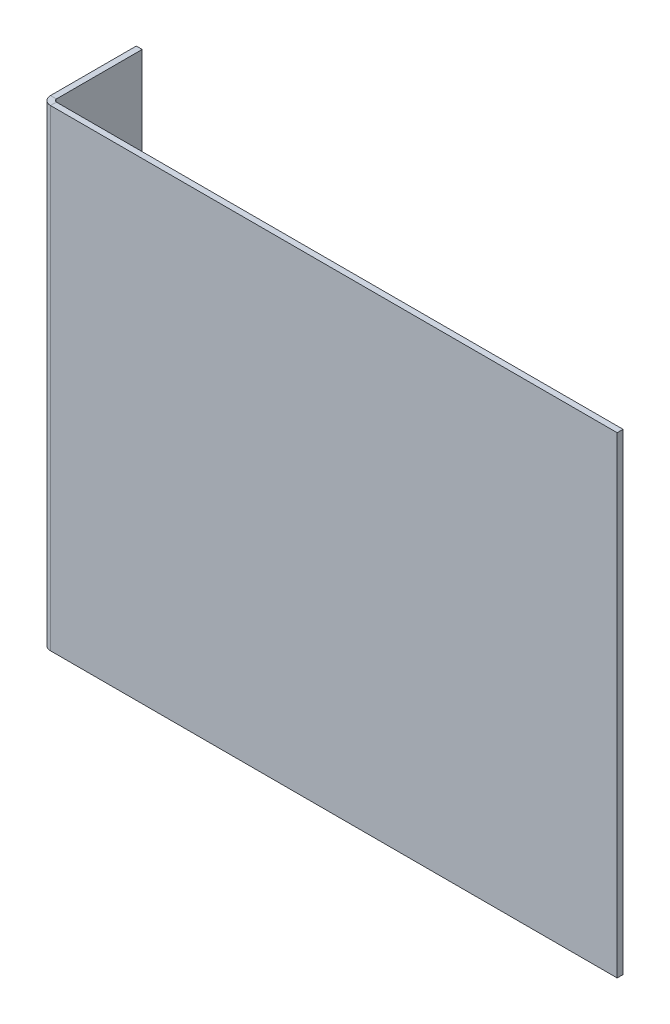
from build123d import *

# Parameters (mm, degrees)
SKETCH1_W          = 152.4
SKETCH1_H          = 127
BASE_FLANGE1_DEPTH = 1.5875
EDGE_FLANGE1_DEPTH = 127


# Sheet-metal steps are written as plain solids
with BuildPart() as part:
    # Sketch1 → Base-Flange1 (new body)
    with BuildSketch(Plane.XY):
        Rectangle(SKETCH1_W, SKETCH1_H)
    extrude(amount=-BASE_FLANGE1_DEPTH)

    # Edge-Flange1 section (across the edge) → Edge-Flange1 (add)
    with BuildSketch(Plane(origin=(-76.9366, -63.5, -1.5875), x_dir=(1, 0, 0), z_dir=(0, 1, 0))):
        with BuildLine():
            Line((-1.5875, 0.7366), (-1.5875, 23.8125))
            Line((-1.5875, 23.8125), (0, 23.8125))
            Line((0, 23.8125), (0, 0.7366))
            ThreePointArc((0, 0.7366), (0.215745145, 0.215745145), (0.7366, 0))
            Line((0.7366, 0), (0.7366, -1.5875))
            ThreePointArc((0.7366, -1.5875), (-0.90678687, -0.90678687), (-1.5875, 0.7366))
        make_face()
    extrude(amount=EDGE_FLANGE1_DEPTH)


solid = part.part
